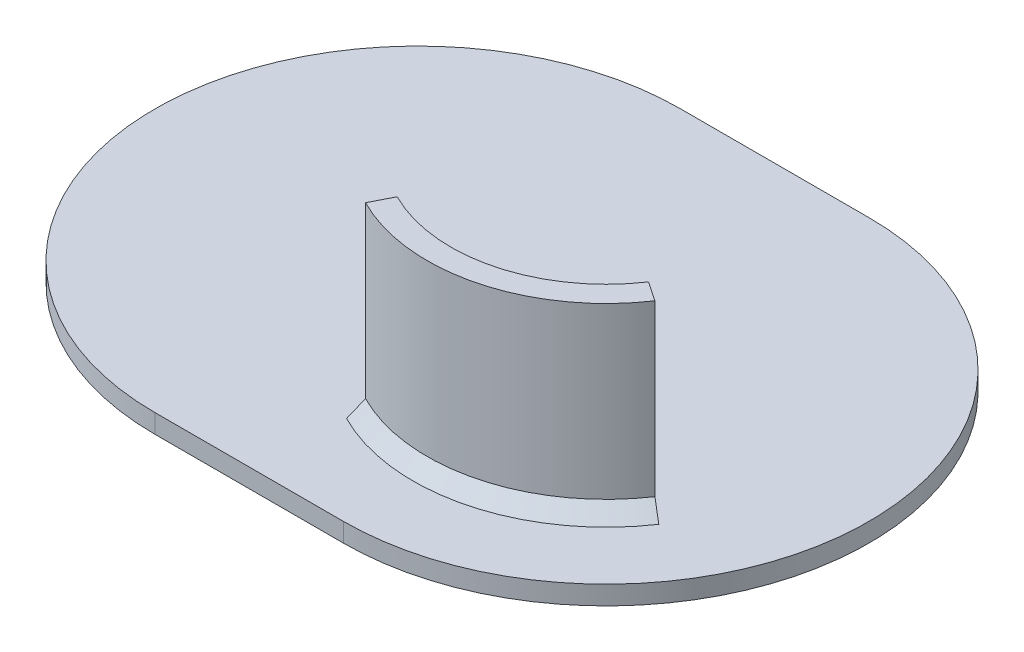
from build123d import *

# Parameters (mm, degrees)
BOSS_EXTRUDE1_DEPTH = 2
EXTRUDE_THIN2_DEPTH = 19.5
CHAMFER1_SIZE       = 1.5


with BuildPart() as part:
    # Sketch1 → Boss-Extrude1 (new body)
    with BuildSketch(Plane.XZ.offset(-2)):
        with BuildLine():
            Line((0, -27.9), (20, -27.9))
            ThreePointArc((20, -27.9), (47.9, 0), (20, 27.9))
            Line((20, 27.9), (0, 27.9))
            ThreePointArc((0, 27.9), (-27.9, 0), (0, -27.9))
        make_face()
    extrude(amount=BOSS_EXTRUDE1_DEPTH)

    # Sketch8 → Extrude-Thin2 (add)
    with BuildSketch(Plane(origin=(0, 2, 0), x_dir=(1, 0, 0), z_dir=(0, 1, 0))):
        with BuildLine():
            ThreePointArc((33.69302994, -9.206026887), (24.155985639, -15.968023778), (12.53247907, -14.71346768))
            Line((12.53247907, -14.71346768), (11.401036505, -16.942780965))
            ThreePointArc((11.401036505, -16.942780965), (24.785680433, -18.38742132), (35.767731446, -10.600879446))
            Line((35.767731446, -10.600879446), (33.69302994, -9.206026887))
        make_face()
    extrude(amount=EXTRUDE_THIN2_DEPTH)

    # Chamfer1
    chamfer1_edges = [part.edges().sort_by_distance(p)[0] for p in [
        (24.785680433, 2, 18.38742132),
        (24.155985639, 2, 15.968023778),
    ]]
    chamfer(chamfer1_edges, length=CHAMFER1_SIZE)


solid = part.part
